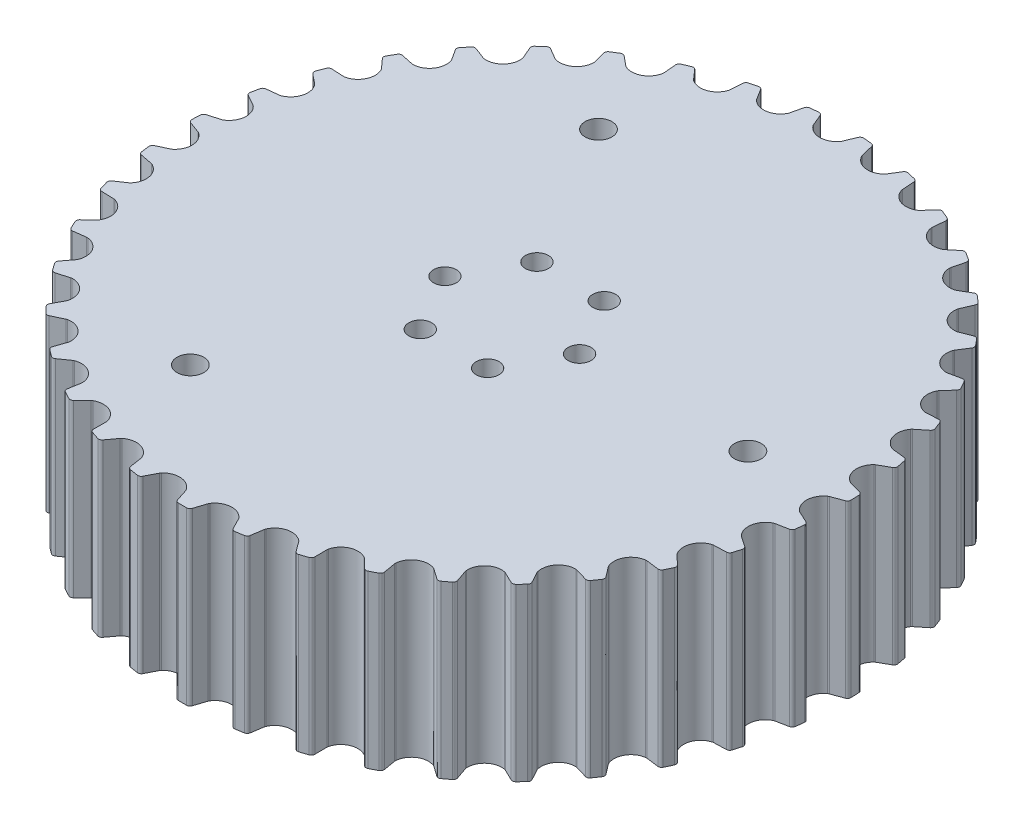
from build123d import *

# Parameters (mm, degrees)
BOSS_EXTRUDE5_DEPTH = 12.7
SKETCH3_R           = 1.7
CUT_EXTRUDE1_DEPTH  = 74.752721321
SKETCH6_R           = 1.985
CUT_EXTRUDE3_DEPTH  = 74.752721321


with BuildPart() as part:
    # Sketch7 → Boss-Extrude5 (new, symmetric)
    with BuildSketch(Plane(origin=(0, 0, 0), x_dir=(1, 0, 0), z_dir=(0, 1, 0))):
        with BuildLine():
            Line((2.822000486, 48.545859401), (2.109171145, 46.838774008))
            ThreePointArc((2.109171145, 46.838774008), (2.064572371, 46.749061356), (2.00858928, 46.665975232))
            ThreePointArc((2.00858928, 46.665975232), (0, 45.6807), (-2.00858928, 46.665975232))
            ThreePointArc((-2.00858928, 46.665975232), (-2.064572371, 46.749061356), (-2.109171145, 46.838774008))
            Line((-2.109171145, 46.838774008), (-2.822000486, 48.545859401))
            ThreePointArc((-2.822000486, 48.545859401), (-3.023690402, 48.782246639), (-3.325310423, 48.856966858))
            ThreePointArc((-3.325310423, 48.856966858), (-3.6329512, 48.83505468), (-3.94044787, 48.811205379))
            ThreePointArc((-3.94044787, 48.811205379), (-4.247788236, 48.785419903), (-4.554960106, 48.757699273))
            ThreePointArc((-4.554960106, 48.757699273), (-4.840688261, 48.635563407), (-5.001847166, 48.369883984))
            Line((-5.001847166, 48.369883984), (-5.4316098, 46.570559031))
            ThreePointArc((-5.4316098, 46.570559031), (-5.46124011, 46.474853988), (-5.503170283, 46.383863488))
            ThreePointArc((-5.503170283, 46.383863488), (-7.327699597, 45.089146932), (-9.468327436, 45.73946273))
            ThreePointArc((-9.468327436, 45.73946273), (-9.536913512, 45.812492591), (-9.595325665, 45.893889341))
            Line((-9.595325665, 45.893889341), (-10.572759808, 47.464522559))
            ThreePointArc((-10.572759808, 47.464522559), (-10.809757072, 47.665495307), (-11.119457159, 47.690864665))
            ThreePointArc((-11.119457159, 47.690864665), (-11.419599108, 47.619887192), (-11.71928808, 47.547020799))
            ThreePointArc((-11.71928808, 47.547020799), (-12.018512188, 47.472268376), (-12.317259561, 47.395632888))
            ThreePointArc((-12.317259561, 47.395632888), (-12.579695641, 47.22924463), (-12.696149604, 46.94115398))
            Line((-12.696149604, 46.94115398), (-12.831714904, 45.096191038))
            ThreePointArc((-12.831714904, 45.096191038), (-12.84560934, 44.996972314), (-12.872400627, 44.900434044))
            ThreePointArc((-12.872400627, 44.900434044), (-14.465615624, 43.329808644), (-16.682840884, 43.628322169))
            ThreePointArc((-16.682840884, 43.628322169), (-16.762253603, 43.689404332), (-16.83296629, 43.760377047))
            Line((-16.83296629, 43.760377047), (-18.049690204, 45.153879515))
            ThreePointArc((-18.049690204, 45.153879515), (-18.315856712, 45.314232683), (-18.625615795, 45.289594128))
            ThreePointArc((-18.625615795, 45.289594128), (-18.910485398, 45.17138964), (-19.194604885, 45.051393356))
            ThreePointArc((-19.194604885, 45.051393356), (-19.477962987, 44.929610035), (-19.760548464, 44.806044508))
            ThreePointArc((-19.760548464, 44.806044508), (-19.992895511, 44.599713226), (-20.061628436, 44.296672744))
            Line((-20.061628436, 44.296672744), (-19.899485332, 42.453855384))
            ThreePointArc((-19.899485332, 42.453855384), (-19.897284037, 42.353692693), (-19.908242555, 42.254106944))
            ThreePointArc((-19.908242555, 42.254106944), (-21.228879805, 40.448251071), (-23.465277517, 40.387230981))
            ThreePointArc((-23.465277517, 40.387230981), (-23.55346013, 40.43478345), (-23.634641931, 40.493493974))
            Line((-23.634641931, 40.493493974), (-25.059143105, 41.67377471))
            ThreePointArc((-25.059143105, 41.67377471), (-25.347585283, 41.789355236), (-25.649380766, 41.715346892))
            ThreePointArc((-25.649380766, 41.715346892), (-25.911600049, 41.552976824), (-26.172791505, 41.388958489))
            ThreePointArc((-26.172791505, 41.388958489), (-26.432944776, 41.223298394), (-26.692049541, 41.056003109))
            ThreePointArc((-26.692049541, 41.056003109), (-26.88828989, 40.815072676), (-26.907521629, 40.504930953))
            Line((-26.907521629, 40.504930953), (-26.451869543, 38.711987177))
            ThreePointArc((-26.451869543, 38.711987177), (-26.433629528, 38.613474678), (-26.428471459, 38.513420668))
            ThreePointArc((-26.428471459, 38.513420668), (-27.44232715, 36.519105042), (-29.639975788, 36.100131724))
            ThreePointArc((-29.639975788, 36.100131724), (-29.734644412, 36.132922916), (-29.82419276, 36.177850678))
            Line((-29.82419276, 36.177850678), (-31.419577363, 37.114341029))
            ThreePointArc((-31.419577363, 37.114341029), (-31.722824711, 37.18215544), (-32.008840248, 37.060694084))
            ThreePointArc((-32.008840248, 37.060694084), (-32.241617869, 36.858363734), (-32.473116574, 36.654571338))
            ThreePointArc((-32.473116574, 36.654571338), (-32.70332718, 36.449324978), (-32.932240555, 36.242632797))
            ThreePointArc((-32.932240555, 36.242632797), (-33.087291684, 35.973343183), (-33.056524146, 35.664132726))
            Line((-33.056524146, 35.664132726), (-32.319164227, 33.967498835))
            ThreePointArc((-32.319164227, 33.967498835), (-32.2853579, 33.873187952), (-32.264216835, 33.775257028))
            ThreePointArc((-32.264216835, 33.775257028), (-32.945032636, 31.644133375), (-35.047014255, 30.878058019))
            ThreePointArc((-35.047014255, 30.878058019), (-35.145717022, 30.895238658), (-35.241312663, 30.925220052))
            Line((-35.241312663, 30.925220052), (-36.966261071, 31.593665412))
            ThreePointArc((-36.966261071, 31.593665412), (-37.276459642, 31.611957348), (-37.539287581, 31.446188766))
            ThreePointArc((-37.539287581, 31.446188766), (-37.736594723, 31.209138385), (-37.932404981, 30.970850043))
            ThreePointArc((-37.932404981, 30.970850043), (-38.126710588, 30.731333191), (-38.319503838, 30.490597332))
            ThreePointArc((-38.319503838, 30.490597332), (-38.429350003, 30.199922998), (-38.349380051, 29.899652195))
            Line((-38.349380051, 29.899652195), (-37.349409534, 28.343270117))
            ThreePointArc((-37.349409534, 28.343270117), (-37.30091246, 28.255603451), (-37.264335941, 28.162331972))
            ThreePointArc((-37.264335941, 28.162331972), (-37.594479083, 25.949595276), (-39.546353463, 24.85625883))
            ThreePointArc((-39.546353463, 24.85625883), (-39.646534023, 24.857383947), (-39.745701079, 24.871642471))
            Line((-39.745701079, 24.871642471), (-41.555538034, 25.254730456))
            ThreePointArc((-41.555538034, 25.254730456), (-41.864653848, 25.223026166), (-42.097487084, 25.017243677))
            ThreePointArc((-42.097487084, 25.017243677), (-42.254213595, 24.751612745), (-42.409264023, 24.485))
            ThreePointArc((-42.409264023, 24.485), (-42.562632219, 24.217416017), (-42.714312099, 23.948871412))
            ThreePointArc((-42.714312099, 23.948871412), (-42.776108344, 23.64434067), (-42.649007158, 23.360786378))
            Line((-42.649007158, 23.360786378), (-41.412324753, 21.98496559))
            ThreePointArc((-41.412324753, 21.98496559), (-41.350392982, 21.906213662), (-41.299328322, 21.820017311))
            ThreePointArc((-41.299328322, 21.820017311), (-41.270248268, 19.58297629), (-43.021462888, 18.190695595))
            ThreePointArc((-43.021462888, 18.190695595), (-43.120526618, 18.17573605), (-43.220696715, 18.173902415))
            Line((-43.220696715, 18.173902415), (-45.068548391, 18.261711246))
            ThreePointArc((-45.068548391, 18.261711246), (-45.36857551, 18.180831855), (-45.565383785, 17.940365118))
            ThreePointArc((-45.565383785, 17.940365118), (-45.67747053, 17.653033336), (-45.787745404, 17.365001318))
            ThreePointArc((-45.787745404, 17.365001318), (-45.896204033, 17.076280489), (-46.002842114, 16.786882302))
            ThreePointArc((-46.002842114, 16.786882302), (-46.014987947, 16.476382339), (-45.844047381, 16.216888464))
            Line((-45.844047381, 16.216888464), (-44.402682514, 15.057262003))
            ThreePointArc((-44.402682514, 15.057262003), (-44.328920045, 14.989464446), (-44.264689792, 14.912575663))
            ThreePointArc((-44.264689792, 14.912575663), (-43.877139702, 12.709168504), (-45.382339023, 11.054002898))
            ThreePointArc((-45.382339023, 11.054002898), (-45.477720223, 11.023346135), (-45.576299008, 11.005467832))
            Line((-45.576299008, 11.005467832), (-47.414307018, 10.795723308))
            ThreePointArc((-47.414307018, 10.795723308), (-47.697474898, 10.667763549), (-47.853160979, 10.398840526))
            ThreePointArc((-47.853160979, 10.398840526), (-47.917704972, 10.097249637), (-47.980348231, 9.795258224))
            ThreePointArc((-47.980348231, 9.795258224), (-48.041088271, 9.492878267), (-48.099922683, 9.190121758))
            ThreePointArc((-48.099922683, 9.190121758), (-48.062103534, 8.88169436), (-47.851750858, 8.652981658))
            Line((-47.851750858, 8.652981658), (-46.243034121, 7.739583239))
            ThreePointArc((-46.243034121, 7.739583239), (-46.159351364, 7.684495975), (-46.083619047, 7.618906138))
            ThreePointArc((-46.083619047, 7.618906138), (-45.347636265, 5.50619993), (-46.567836415, 3.631017333))
            ThreePointArc((-46.567836415, 3.631017333), (-46.657064764, 3.585457347), (-46.751499097, 3.551997413))
            Line((-46.751499097, 3.551997413), (-48.532059998, 3.050131807))
            ThreePointArc((-48.532059998, 3.050131807), (-48.79103474, 2.878405771), (-48.901566441, 2.587991426))
            ThreePointArc((-48.901566441, 2.587991426), (-48.916896025, 2.279952476), (-48.93028524, 1.971823087))
            ThreePointArc((-48.93028524, 1.971823087), (-48.941733557, 1.663615483), (-48.951240519, 1.355341889))
            ThreePointArc((-48.951240519, 1.355341889), (-48.864435884, 1.056975162), (-48.620119123, 0.864967171))
            Line((-48.620119123, 0.864967171), (-46.885715435, 0.221453334))
            ThreePointArc((-46.885715435, 0.221453334), (-46.794279729, 0.180503095), (-46.709006776, 0.127910947))
            ThreePointArc((-46.709006776, 0.127910947), (-45.643652869, -1.83937633), (-46.547251305, -3.886009674))
            ThreePointArc((-46.547251305, -3.886009674), (-46.628015834, -3.945292904), (-46.715859917, -3.993467872))
            Line((-46.715859917, -3.993467872), (-48.392858117, -4.774456506))
            ThreePointArc((-48.392858117, -4.774456506), (-48.620932411, -4.985501205), (-48.683447018, -5.289885292))
            ThreePointArc((-48.683447018, -5.289885292), (-48.649165166, -5.596394257), (-48.612953565, -5.902681232))
            ThreePointArc((-48.612953565, -5.902681232), (-48.574813651, -6.208734068), (-48.534746939, -6.514540624))
            ThreePointArc((-48.534746939, -6.514540624), (-48.401205013, -6.795119137), (-48.129251841, -6.94544951))
            Line((-48.129251841, -6.94544951), (-46.314081347, -7.302412095))
            ThreePointArc((-46.314081347, -7.302412095), (-46.217260829, -7.328164721), (-46.124655765, -7.366397071))
            ThreePointArc((-46.124655765, -7.366397071), (-44.757522839, -9.13731371), (-45.321116836, -11.302391072))
            ThreePointArc((-45.321116836, -11.302391072), (-45.391325787, -11.373862141), (-45.470304504, -11.435504438))
            Line((-45.470304504, -11.435504438), (-47.000306631, -12.475388903))
            ThreePointArc((-47.000306631, -12.475388903), (-47.191573472, -12.720286318), (-47.20445189, -13.030756759))
            ThreePointArc((-47.20445189, -13.030756759), (-47.121446483, -13.327797318), (-47.036571927, -13.624309208))
            ThreePointArc((-47.036571927, -13.624309208), (-46.949831588, -13.920280668), (-46.861228908, -14.215699957))
            ThreePointArc((-46.861228908, -14.215699957), (-46.684408355, -14.47122342), (-46.391862218, -14.575982698))
            Line((-46.391862218, -14.575982698), (-44.54293688, -14.637148887))
            ThreePointArc((-44.54293688, -14.637148887), (-44.443239151, -14.64703692), (-44.345700397, -14.669919274))
            ThreePointArc((-44.345700397, -14.669919274), (-42.712196477, -16.198599464), (-42.921189248, -18.426046478))
            ThreePointArc((-42.921189248, -18.426046478), (-42.979024246, -18.507854323), (-43.047092089, -18.581367445))
            Line((-43.047092089, -18.581367445), (-44.390471891, -19.853215281))
            ThreePointArc((-44.390471891, -19.853215281), (-44.539977568, -20.125622698), (-44.502886254, -20.434138471))
            ThreePointArc((-44.502886254, -20.434138471), (-44.373307088, -20.714017429), (-44.241967783, -20.993074732))
            ThreePointArc((-44.241967783, -20.993074732), (-44.108873548, -21.27129931), (-43.974029663, -21.548680127))
            ThreePointArc((-43.974029663, -21.548680127), (-43.758510044, -21.772530618), (-43.452947733, -21.82900559))
            Line((-43.452947733, -21.82900559), (-41.618153745, -21.592791211))
            ThreePointArc((-41.618153745, -21.592791211), (-41.518160923, -21.586558556), (-41.418214683, -21.593498274))
            ThreePointArc((-41.418214683, -21.593498274), (-39.560646663, -22.84035), (-39.409625403, -25.072476958))
            ThreePointArc((-39.409625403, -25.072476958), (-39.453588552, -25.1625028), (-39.5089826, -25.245982796))
            Line((-39.5089826, -25.245982796), (-40.630947247, -26.716853811))
            ThreePointArc((-40.630947247, -26.716853811), (-40.734819642, -27.009716021), (-40.64871924, -27.308286731))
            ThreePointArc((-40.64871924, -27.308286731), (-40.475922348, -27.56375537), (-40.301519913, -27.818130647))
            ThreePointArc((-40.301519913, -27.818130647), (-40.125518852, -28.071402474), (-39.947926148, -28.323560802))
            ThreePointArc((-39.947926148, -28.323560802), (-39.699289307, -28.50994071), (-39.388624725, -28.516668704))
            Line((-39.388624725, -28.516668704), (-37.615482289, -27.989191586))
            ThreePointArc((-37.615482289, -27.989191586), (-37.517784136, -27.966999665), (-37.418018965, -27.957817011))
            ThreePointArc((-37.418018965, -27.957817011), (-35.38449688, -28.890547469), (-34.877372962, -31.069543456))
            ThreePointArc((-34.877372962, -31.069543456), (-34.906325638, -31.165455671), (-34.947611215, -31.256740454))
            Line((-34.947611215, -31.256740454), (-35.819102411, -32.888539861))
            ThreePointArc((-35.819102411, -32.888539861), (-35.874651284, -33.194271886), (-35.741771749, -33.475164708))
            ThreePointArc((-35.741771749, -33.475164708), (-35.53023248, -33.699606525), (-35.317283846, -33.922711591))
            ThreePointArc((-35.317283846, -33.922711591), (-35.102934295, -34.144471058), (-34.887192329, -34.364876129))
            ThreePointArc((-34.887192329, -34.364876129), (-34.611877831, -34.508958312), (-34.304157028, -34.465765077))
            Line((-34.304157028, -34.465765077), (-32.638589601, -33.6606866))
            ThreePointArc((-32.638589601, -33.6606866), (-32.545716447, -33.623110173), (-32.44871621, -33.598042972))
            ThreePointArc((-32.44871621, -33.598042972), (-30.291907214, -34.192494934), (-29.44181488, -36.261925098))
            ThreePointArc((-29.44181488, -36.261925098), (-29.455007226, -36.361239611), (-29.481115057, -36.457964952))
            Line((-29.481115057, -36.457964952), (-30.079561637, -38.208430005))
            ThreePointArc((-30.079561637, -38.208430005), (-30.085348301, -38.519113546), (-29.909131144, -38.775053504))
            ThreePointArc((-29.909131144, -38.775053504), (-29.664328254, -38.962655572), (-29.41834868, -39.148712124))
            ThreePointArc((-29.41834868, -39.148712124), (-29.171202179, -39.333215778), (-28.922898555, -39.516159216))
            ThreePointArc((-28.922898555, -39.516159216), (-28.6280369, -39.614212021), (-28.331229682, -39.522216239))
            Line((-28.331229682, -39.522216239), (-26.816374585, -38.460387512))
            ThreePointArc((-26.816374585, -38.460387512), (-26.730731797, -38.408399788), (-26.63900875, -38.368097269))
            ThreePointArc((-26.63900875, -38.368097269), (-24.414773064, -38.608874741), (-23.243729259, -40.515141927))
            ThreePointArc((-23.243729259, -40.515141927), (-23.240819599, -40.615286545), (-23.251073504, -40.714947309))
            Line((-23.251073504, -40.714947309), (-23.560976017, -42.538741881))
            ThreePointArc((-23.560976017, -42.538741881), (-23.516850601, -42.846330398), (-23.301859753, -43.070688781))
            ThreePointArc((-23.301859753, -43.070688781), (-23.030133508, -43.216592307), (-22.757493735, -43.360781576))
            ThreePointArc((-22.757493735, -43.360781576), (-22.483951249, -43.50325087), (-22.2095169, -43.643994536))
            ThreePointArc((-22.2095169, -43.643994536), (-21.90274485, -43.693478447), (-21.624538369, -43.55506276))
            Line((-21.624538369, -43.55506276), (-20.299629554, -42.26398459))
            ThreePointArc((-20.299629554, -42.26398459), (-20.223435235, -42.198932025), (-20.139364956, -42.144438001))
            ThreePointArc((-20.139364956, -42.144438001), (-17.905309115, -42.025304972), (-16.443643259, -43.719037862))
            ThreePointArc((-16.443643259, -43.719037862), (-16.424706952, -43.817418891), (-16.418841361, -43.917433917))
            Line((-16.418841361, -43.917433917), (-16.432173495, -45.767322687))
            ThreePointArc((-16.432173495, -45.767322687), (-16.339278823, -46.063849799), (-16.091082435, -46.250815842))
            ThreePointArc((-16.091082435, -46.250815842), (-15.799470401, -46.351242001), (-15.507231656, -46.449829562))
            ThreePointArc((-15.507231656, -46.449829562), (-15.214377792, -46.546574615), (-14.920920424, -46.641473322))
            ThreePointArc((-14.920920424, -46.641473322), (-14.610183214, -46.641106732), (-14.357782872, -46.459856034))
            Line((-14.357782872, -46.459856034), (-13.257134781, -44.972966667))
            ThreePointArc((-13.257134781, -44.972966667), (-13.192362324, -44.896534087), (-13.118122188, -44.829259926))
            ThreePointArc((-13.118122188, -44.829259926), (-10.932107066, -44.353301879), (-9.217675536, -45.790633682))
            ThreePointArc((-9.217675536, -45.790633682), (-9.183203023, -45.884703104), (-9.161369851, -45.982482055))
            Line((-9.161369851, -45.982482055), (-8.87778631, -47.810553876))
            ThreePointArc((-8.87778631, -47.810553876), (-8.738528306, -48.088339687), (-8.463554533, -48.233071068))
            ThreePointArc((-8.463554533, -48.233071068), (-8.15960931, -48.285418875), (-7.855340424, -48.335851361))
            ThreePointArc((-7.855340424, -48.335851361), (-7.550759942, -48.384366528), (-7.245879947, -48.43096245))
            ThreePointArc((-7.245879947, -48.43096245), (-6.939225507, -48.380754853), (-6.719168339, -48.161363441))
            Line((-6.719168339, -48.161363441), (-5.87128718, -46.517172531))
            ThreePointArc((-5.87128718, -46.517172531), (-5.819614157, -46.4313395), (-5.757126947, -46.353027566))
            ThreePointArc((-5.757126947, -46.353027566), (-3.675769186, -45.532571566), (-1.752974859, -46.676276141))
            ThreePointArc((-1.752974859, -46.676276141), (-1.703858959, -46.76359761), (-1.666623674, -46.856608061))
            Line((-1.666623674, -46.856608061), (-1.093469123, -48.615516833))
            ThreePointArc((-1.093469123, -48.615516833), (-0.911454496, -48.867366836), (-0.616825015, -48.966115089))
            ThreePointArc((-0.616825015, -48.966115089), (-0.308418624, -48.969028763), (0, -48.97))
            ThreePointArc((0, -48.97), (0.308418624, -48.969028763), (0.616825015, -48.966115089))
            ThreePointArc((0.616825015, -48.966115089), (0.911454496, -48.867366836), (1.093469123, -48.615516833))
            Line((1.093469123, -48.615516833), (1.666623674, -46.856608061))
            ThreePointArc((1.666623674, -46.856608061), (1.703858959, -46.76359761), (1.752974859, -46.676276141))
            ThreePointArc((1.752974859, -46.676276141), (3.675769186, -45.532571566), (5.757126947, -46.353027566))
            ThreePointArc((5.757126947, -46.353027566), (5.819614157, -46.4313395), (5.87128718, -46.517172531))
            Line((5.87128718, -46.517172531), (6.719168339, -48.161363441))
            ThreePointArc((6.719168339, -48.161363441), (6.939225507, -48.380754853), (7.245879947, -48.43096245))
            ThreePointArc((7.245879947, -48.43096245), (7.550759942, -48.384366528), (7.855340424, -48.335851361))
            ThreePointArc((7.855340424, -48.335851361), (8.15960931, -48.285418875), (8.463554533, -48.233071068))
            ThreePointArc((8.463554533, -48.233071068), (8.738528306, -48.088339687), (8.87778631, -47.810553876))
            Line((8.87778631, -47.810553876), (9.161369851, -45.982482055))
            ThreePointArc((9.161369851, -45.982482055), (9.183203023, -45.884703104), (9.217675536, -45.790633682))
            ThreePointArc((9.217675536, -45.790633682), (10.932107066, -44.353301879), (13.118122188, -44.829259926))
            ThreePointArc((13.118122188, -44.829259926), (13.192362324, -44.896534087), (13.257134781, -44.972966667))
            Line((13.257134781, -44.972966667), (14.357782872, -46.459856034))
            ThreePointArc((14.357782872, -46.459856034), (14.610183214, -46.641106732), (14.920920424, -46.641473322))
            ThreePointArc((14.920920424, -46.641473322), (15.214377792, -46.546574615), (15.507231656, -46.449829562))
            ThreePointArc((15.507231656, -46.449829562), (15.799470401, -46.351242001), (16.091082435, -46.250815842))
            ThreePointArc((16.091082435, -46.250815842), (16.339278823, -46.063849799), (16.432173495, -45.767322687))
            Line((16.432173495, -45.767322687), (16.418841361, -43.917433917))
            ThreePointArc((16.418841361, -43.917433917), (16.424706952, -43.817418891), (16.443643259, -43.719037862))
            ThreePointArc((16.443643259, -43.719037862), (17.905309115, -42.025304972), (20.139364956, -42.144438001))
            ThreePointArc((20.139364956, -42.144438001), (20.223435235, -42.198932025), (20.299629554, -42.26398459))
            Line((20.299629554, -42.26398459), (21.624538369, -43.55506276))
            ThreePointArc((21.624538369, -43.55506276), (21.90274485, -43.693478447), (22.2095169, -43.643994536))
            ThreePointArc((22.2095169, -43.643994536), (22.483951249, -43.50325087), (22.757493735, -43.360781576))
            ThreePointArc((22.757493735, -43.360781576), (23.030133508, -43.216592307), (23.301859753, -43.070688781))
            ThreePointArc((23.301859753, -43.070688781), (23.516850601, -42.846330398), (23.560976017, -42.538741881))
            Line((23.560976017, -42.538741881), (23.251073504, -40.714947309))
            ThreePointArc((23.251073504, -40.714947309), (23.240819599, -40.615286545), (23.243729259, -40.515141927))
            ThreePointArc((23.243729259, -40.515141927), (24.414773064, -38.608874741), (26.63900875, -38.368097269))
            ThreePointArc((26.63900875, -38.368097269), (26.730731797, -38.408399788), (26.816374585, -38.460387512))
            Line((26.816374585, -38.460387512), (28.331229682, -39.522216239))
            ThreePointArc((28.331229682, -39.522216239), (28.6280369, -39.614212021), (28.922898555, -39.516159216))
            ThreePointArc((28.922898555, -39.516159216), (29.171202179, -39.333215778), (29.41834868, -39.148712124))
            ThreePointArc((29.41834868, -39.148712124), (29.664328254, -38.962655572), (29.909131144, -38.775053504))
            ThreePointArc((29.909131144, -38.775053504), (30.085348301, -38.519113546), (30.079561637, -38.208430005))
            Line((30.079561637, -38.208430005), (29.481115057, -36.457964952))
            ThreePointArc((29.481115057, -36.457964952), (29.455007226, -36.361239611), (29.44181488, -36.261925098))
            ThreePointArc((29.44181488, -36.261925098), (30.291907214, -34.192494934), (32.44871621, -33.598042972))
            ThreePointArc((32.44871621, -33.598042972), (32.545716447, -33.623110173), (32.638589601, -33.6606866))
            Line((32.638589601, -33.6606866), (34.304157028, -34.465765077))
            ThreePointArc((34.304157028, -34.465765077), (34.611877831, -34.508958312), (34.887192329, -34.364876129))
            ThreePointArc((34.887192329, -34.364876129), (35.102934295, -34.144471058), (35.317283846, -33.922711591))
            ThreePointArc((35.317283846, -33.922711591), (35.53023248, -33.699606525), (35.741771749, -33.475164708))
            ThreePointArc((35.741771749, -33.475164708), (35.874651284, -33.194271886), (35.819102411, -32.888539861))
            Line((35.819102411, -32.888539861), (34.947611215, -31.256740454))
            ThreePointArc((34.947611215, -31.256740454), (34.906325638, -31.165455671), (34.877372962, -31.069543456))
            ThreePointArc((34.877372962, -31.069543456), (35.38449688, -28.890547469), (37.418018965, -27.957817011))
            ThreePointArc((37.418018965, -27.957817011), (37.517784136, -27.966999665), (37.615482289, -27.989191586))
            Line((37.615482289, -27.989191586), (39.388624725, -28.516668704))
            ThreePointArc((39.388624725, -28.516668704), (39.699289307, -28.50994071), (39.947926148, -28.323560802))
            ThreePointArc((39.947926148, -28.323560802), (40.125518852, -28.071402474), (40.301519913, -27.818130647))
            ThreePointArc((40.301519913, -27.818130647), (40.475922348, -27.56375537), (40.64871924, -27.308286731))
            ThreePointArc((40.64871924, -27.308286731), (40.734819642, -27.009716021), (40.630947247, -26.716853811))
            Line((40.630947247, -26.716853811), (39.5089826, -25.245982796))
            ThreePointArc((39.5089826, -25.245982796), (39.453588552, -25.1625028), (39.409625403, -25.072476958))
            ThreePointArc((39.409625403, -25.072476958), (39.560646663, -22.84035), (41.418214683, -21.593498274))
            ThreePointArc((41.418214683, -21.593498274), (41.518160923, -21.586558556), (41.618153745, -21.592791211))
            Line((41.618153745, -21.592791211), (43.452947733, -21.82900559))
            ThreePointArc((43.452947733, -21.82900559), (43.758510044, -21.772530618), (43.974029663, -21.548680127))
            ThreePointArc((43.974029663, -21.548680127), (44.108873548, -21.27129931), (44.241967783, -20.993074732))
            ThreePointArc((44.241967783, -20.993074732), (44.373307088, -20.714017429), (44.502886254, -20.434138471))
            ThreePointArc((44.502886254, -20.434138471), (44.539977568, -20.125622698), (44.390471891, -19.853215281))
            Line((44.390471891, -19.853215281), (43.047092089, -18.581367445))
            ThreePointArc((43.047092089, -18.581367445), (42.979024246, -18.507854323), (42.921189248, -18.426046478))
            ThreePointArc((42.921189248, -18.426046478), (42.712196477, -16.198599464), (44.345700397, -14.669919274))
            ThreePointArc((44.345700397, -14.669919274), (44.443239151, -14.64703692), (44.54293688, -14.637148887))
            Line((44.54293688, -14.637148887), (46.391862218, -14.575982698))
            ThreePointArc((46.391862218, -14.575982698), (46.684408355, -14.47122342), (46.861228908, -14.215699957))
            ThreePointArc((46.861228908, -14.215699957), (46.949831588, -13.920280668), (47.036571927, -13.624309208))
            ThreePointArc((47.036571927, -13.624309208), (47.121446483, -13.327797318), (47.20445189, -13.030756759))
            ThreePointArc((47.20445189, -13.030756759), (47.191573472, -12.720286318), (47.000306631, -12.475388903))
            Line((47.000306631, -12.475388903), (45.470304504, -11.435504438))
            ThreePointArc((45.470304504, -11.435504438), (45.391325787, -11.373862141), (45.321116836, -11.302391072))
            ThreePointArc((45.321116836, -11.302391072), (44.757522839, -9.13731371), (46.124655765, -7.366397071))
            ThreePointArc((46.124655765, -7.366397071), (46.217260829, -7.328164721), (46.314081347, -7.302412095))
            Line((46.314081347, -7.302412095), (48.129251841, -6.94544951))
            ThreePointArc((48.129251841, -6.94544951), (48.401205013, -6.795119137), (48.534746939, -6.514540624))
            ThreePointArc((48.534746939, -6.514540624), (48.574813651, -6.208734068), (48.612953565, -5.902681232))
            ThreePointArc((48.612953565, -5.902681232), (48.649165166, -5.596394257), (48.683447018, -5.289885292))
            ThreePointArc((48.683447018, -5.289885292), (48.620932411, -4.985501205), (48.392858117, -4.774456506))
            Line((48.392858117, -4.774456506), (46.715859917, -3.993467872))
            ThreePointArc((46.715859917, -3.993467872), (46.628015834, -3.945292904), (46.547251305, -3.886009674))
            ThreePointArc((46.547251305, -3.886009674), (45.643652869, -1.83937633), (46.709006776, 0.127910947))
            ThreePointArc((46.709006776, 0.127910947), (46.794279729, 0.180503095), (46.885715435, 0.221453334))
            Line((46.885715435, 0.221453334), (48.620119123, 0.864967171))
            ThreePointArc((48.620119123, 0.864967171), (48.864435884, 1.056975162), (48.951240519, 1.355341889))
            ThreePointArc((48.951240519, 1.355341889), (48.941733557, 1.663615483), (48.93028524, 1.971823087))
            ThreePointArc((48.93028524, 1.971823087), (48.916896025, 2.279952476), (48.901566441, 2.587991426))
            ThreePointArc((48.901566441, 2.587991426), (48.79103474, 2.878405771), (48.532059998, 3.050131807))
            Line((48.532059998, 3.050131807), (46.751499097, 3.551997414))
            ThreePointArc((46.751499097, 3.551997414), (46.657064764, 3.585457347), (46.567836415, 3.631017333))
            ThreePointArc((46.567836415, 3.631017333), (45.347636265, 5.50619993), (46.083619047, 7.618906138))
            ThreePointArc((46.083619047, 7.618906138), (46.159351364, 7.684495975), (46.243034121, 7.739583239))
            Line((46.243034121, 7.739583239), (47.851750858, 8.652981658))
            ThreePointArc((47.851750858, 8.652981658), (48.062103534, 8.88169436), (48.099922683, 9.190121758))
            ThreePointArc((48.099922683, 9.190121758), (48.041088271, 9.492878267), (47.980348231, 9.795258224))
            ThreePointArc((47.980348231, 9.795258224), (47.917704972, 10.097249637), (47.853160979, 10.398840526))
            ThreePointArc((47.853160979, 10.398840526), (47.697474898, 10.667763549), (47.414307018, 10.795723308))
            Line((47.414307018, 10.795723308), (45.576299008, 11.005467832))
            ThreePointArc((45.576299008, 11.005467832), (45.477720223, 11.023346135), (45.382339023, 11.054002898))
            ThreePointArc((45.382339023, 11.054002898), (43.877139702, 12.709168504), (44.264689792, 14.912575663))
            ThreePointArc((44.264689792, 14.912575663), (44.328920045, 14.989464446), (44.402682514, 15.057262003))
            Line((44.402682514, 15.057262003), (45.844047381, 16.216888464))
            ThreePointArc((45.844047381, 16.216888464), (46.014987947, 16.476382339), (46.002842114, 16.786882302))
            ThreePointArc((46.002842114, 16.786882302), (45.896204033, 17.076280489), (45.787745404, 17.365001318))
            ThreePointArc((45.787745404, 17.365001318), (45.67747053, 17.653033336), (45.565383785, 17.940365118))
            ThreePointArc((45.565383785, 17.940365118), (45.36857551, 18.180831855), (45.068548391, 18.261711246))
            Line((45.068548391, 18.261711246), (43.220696715, 18.173902415))
            ThreePointArc((43.220696715, 18.173902415), (43.120526618, 18.17573605), (43.021462888, 18.190695595))
            ThreePointArc((43.021462888, 18.190695595), (41.270248268, 19.58297629), (41.299328322, 21.820017311))
            ThreePointArc((41.299328322, 21.820017311), (41.350392982, 21.906213662), (41.412324753, 21.98496559))
            Line((41.412324753, 21.98496559), (42.649007158, 23.360786378))
            ThreePointArc((42.649007158, 23.360786378), (42.776108344, 23.64434067), (42.714312099, 23.948871412))
            ThreePointArc((42.714312099, 23.948871412), (42.562632219, 24.217416017), (42.409264023, 24.485))
            ThreePointArc((42.409264023, 24.485), (42.254213595, 24.751612745), (42.097487084, 25.017243677))
            ThreePointArc((42.097487084, 25.017243677), (41.864653848, 25.223026166), (41.555538034, 25.254730456))
            Line((41.555538034, 25.254730456), (39.745701079, 24.871642471))
            ThreePointArc((39.745701079, 24.871642471), (39.646534023, 24.857383947), (39.546353463, 24.85625883))
            ThreePointArc((39.546353463, 24.85625883), (37.594479083, 25.949595276), (37.264335941, 28.162331972))
            ThreePointArc((37.264335941, 28.162331972), (37.30091246, 28.255603451), (37.349409534, 28.343270117))
            Line((37.349409534, 28.343270117), (38.349380051, 29.899652195))
            ThreePointArc((38.349380051, 29.899652195), (38.429350003, 30.199922998), (38.319503838, 30.490597332))
            ThreePointArc((38.319503838, 30.490597332), (38.126710588, 30.731333191), (37.932404981, 30.970850043))
            ThreePointArc((37.932404981, 30.970850043), (37.736594723, 31.209138385), (37.539287581, 31.446188766))
            ThreePointArc((37.539287581, 31.446188766), (37.276459642, 31.611957348), (36.966261071, 31.593665412))
            Line((36.966261071, 31.593665412), (35.241312663, 30.925220052))
            ThreePointArc((35.241312663, 30.925220052), (35.145717022, 30.895238658), (35.047014255, 30.878058019))
            ThreePointArc((35.047014255, 30.878058019), (32.945032636, 31.644133375), (32.264216835, 33.775257028))
            ThreePointArc((32.264216835, 33.775257028), (32.2853579, 33.873187952), (32.319164227, 33.967498835))
            Line((32.319164227, 33.967498835), (33.056524146, 35.664132726))
            ThreePointArc((33.056524146, 35.664132726), (33.087291684, 35.973343183), (32.932240555, 36.242632797))
            ThreePointArc((32.932240555, 36.242632797), (32.70332718, 36.449324978), (32.473116574, 36.654571338))
            ThreePointArc((32.473116574, 36.654571338), (32.241617869, 36.858363734), (32.008840248, 37.060694084))
            ThreePointArc((32.008840248, 37.060694084), (31.722824711, 37.18215544), (31.419577363, 37.114341029))
            Line((31.419577363, 37.114341029), (29.82419276, 36.177850678))
            ThreePointArc((29.82419276, 36.177850678), (29.734644412, 36.132922916), (29.639975788, 36.100131724))
            ThreePointArc((29.639975788, 36.100131724), (27.44232715, 36.519105042), (26.428471459, 38.513420668))
            ThreePointArc((26.428471459, 38.513420668), (26.433629528, 38.613474678), (26.451869543, 38.711987177))
            Line((26.451869543, 38.711987177), (26.907521629, 40.504930953))
            ThreePointArc((26.907521629, 40.504930953), (26.88828989, 40.815072676), (26.692049541, 41.056003109))
            ThreePointArc((26.692049541, 41.056003109), (26.432944776, 41.223298394), (26.172791505, 41.388958489))
            ThreePointArc((26.172791505, 41.388958489), (25.911600049, 41.552976824), (25.649380766, 41.715346892))
            ThreePointArc((25.649380766, 41.715346892), (25.347585283, 41.789355236), (25.059143105, 41.67377471))
            Line((25.059143105, 41.67377471), (23.634641931, 40.493493974))
            ThreePointArc((23.634641931, 40.493493974), (23.55346013, 40.43478345), (23.465277517, 40.387230981))
            ThreePointArc((23.465277517, 40.387230981), (21.228879805, 40.448251071), (19.908242555, 42.254106944))
            ThreePointArc((19.908242555, 42.254106944), (19.897284037, 42.353692693), (19.899485332, 42.453855384))
            Line((19.899485332, 42.453855384), (20.061628436, 44.296672744))
            ThreePointArc((20.061628436, 44.296672744), (19.992895511, 44.599713226), (19.760548464, 44.806044508))
            ThreePointArc((19.760548464, 44.806044508), (19.477962987, 44.929610035), (19.194604885, 45.051393356))
            ThreePointArc((19.194604885, 45.051393356), (18.910485398, 45.17138964), (18.625615795, 45.289594128))
            ThreePointArc((18.625615795, 45.289594128), (18.315856712, 45.314232683), (18.049690204, 45.153879515))
            Line((18.049690204, 45.153879515), (16.83296629, 43.760377047))
            ThreePointArc((16.83296629, 43.760377047), (16.762253603, 43.689404332), (16.682840884, 43.628322169))
            ThreePointArc((16.682840884, 43.628322169), (14.465615624, 43.329808644), (12.872400627, 44.900434044))
            ThreePointArc((12.872400627, 44.900434044), (12.84560934, 44.996972314), (12.831714904, 45.096191038))
            Line((12.831714904, 45.096191038), (12.696149604, 46.94115398))
            ThreePointArc((12.696149604, 46.94115398), (12.579695641, 47.22924463), (12.317259561, 47.395632888))
            ThreePointArc((12.317259561, 47.395632888), (12.018512188, 47.472268376), (11.71928808, 47.547020799))
            ThreePointArc((11.71928808, 47.547020799), (11.419599108, 47.619887192), (11.119457159, 47.690864665))
            ThreePointArc((11.119457159, 47.690864665), (10.809757072, 47.665495307), (10.572759808, 47.464522559))
            Line((10.572759808, 47.464522559), (9.595325665, 45.893889341))
            ThreePointArc((9.595325665, 45.893889341), (9.536913512, 45.812492591), (9.468327436, 45.73946273))
            ThreePointArc((9.468327436, 45.73946273), (7.327699597, 45.089146932), (5.503170283, 46.383863488))
            ThreePointArc((5.503170283, 46.383863488), (5.46124011, 46.474853988), (5.4316098, 46.570559031))
            Line((5.4316098, 46.570559031), (5.001847166, 48.369883984))
            ThreePointArc((5.001847166, 48.369883984), (4.840688261, 48.635563407), (4.554960106, 48.757699273))
            ThreePointArc((4.554960106, 48.757699273), (4.247788236, 48.785419903), (3.94044787, 48.811205379))
            ThreePointArc((3.94044787, 48.811205379), (3.6329512, 48.83505468), (3.325310423, 48.856966858))
            ThreePointArc((3.325310423, 48.856966858), (3.023690402, 48.782246639), (2.822000486, 48.545859401))
        make_face()
    extrude(amount=BOSS_EXTRUDE5_DEPTH, both=True)

    # Sketch3 → Cut-Extrude1 (cut, through all)
    with BuildSketch(Plane(origin=(0, -12.7, 0), x_dir=(1, 0, 0), z_dir=(0, 1, 0))):
        with Locations((10, 0)):
            Circle(SKETCH3_R)
        with Locations((5, -8.660254038)):
            Circle(SKETCH3_R)
        with Locations((-5, -8.660254038)):
            Circle(SKETCH3_R)
        with Locations((-10, 0)):
            Circle(SKETCH3_R)
        with Locations((-5, 8.660254038)):
            Circle(SKETCH3_R)
        with Locations((5, 8.660254038)):
            Circle(SKETCH3_R)
    extrude(amount=CUT_EXTRUDE1_DEPTH, mode=Mode.SUBTRACT)

    # Sketch6 → Cut-Extrude3 (cut, through all)
    with BuildSketch(Plane.XZ.offset(12.7)):
        with Locations((35, 0)):
            Circle(SKETCH6_R)
        with Locations((-17.5, -30.310889132)):
            Circle(SKETCH6_R)
        with Locations((-17.5, 30.310889132)):
            Circle(SKETCH6_R)
    extrude(amount=-CUT_EXTRUDE3_DEPTH, mode=Mode.SUBTRACT)


solid = part.part
